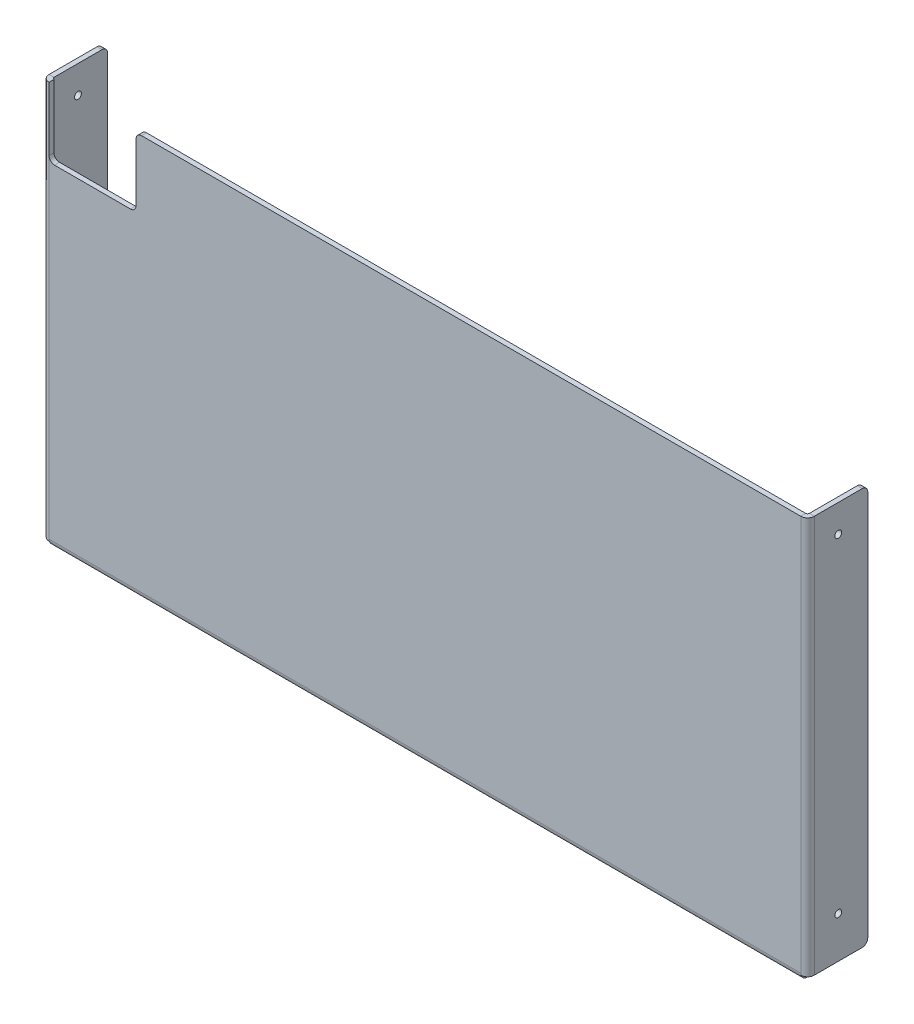
from build123d import *

# Parameters (mm, degrees)
SKETCH1_W                      = 347.1920001
SKETCH1_H                      = 182.714000078
BASE_FLANGE1_DEPTH             = 2.286
EDGE_FLANGE1_STRIP_W           = 10.7696
EDGE_FLANGE1_STRIP_H           = 2.286
EDGE_FLANGE1_STRIP_CUT_DEPTH   = 182.714000078
EDGE_FLANGE1_STRIP_2_W         = 10.7696
EDGE_FLANGE1_STRIP_2_H         = 2.286
EDGE_FLANGE1_STRIP_CUT_2_DEPTH = 182.714000078
EDGE_FLANGE1_DEPTH             = 182.714000078
EDGE_FLANGE1_BEND_DEPTH        = 182.714000078
EDGE_FLANGE2_STRIP_W           = 10.7696
EDGE_FLANGE2_STRIP_H           = 2.286
EDGE_FLANGE2_STRIP_CUT_DEPTH   = 345.5664001
EDGE_FLANGE2_DEPTH             = 345.5664001
SKETCH17_W                     = 40
SKETCH17_H                     = 31.75
CUT_EXTRUDE1_DEPTH             = 201.869732409
FILLET1_R                      = 2.54
F_1_8_0_1250_DOWEL_HOLE1_D     = 3.175
F_1_8_0_1250_DOWEL_HOLE1_DEPTH = 351.7640001
F_1_8_0_1250_DOWEL_HOLE1_TIP   = 0.953866233


# Sheet-metal steps are written as plain solids
with BuildPart() as part:
    # Sketch1 → Base-Flange1 (new body)
    with BuildSketch(Plane.XY):
        Rectangle(SKETCH1_W, SKETCH1_H)
    extrude(amount=-BASE_FLANGE1_DEPTH)

    # Edge-Flange1 strip (across the edge) → Edge-Flange1 strip cut (cut)
    with BuildSketch(Plane(origin=(173.59600005, 91.357000039, -2.286), x_dir=(-1, 0, 0), z_dir=(0, -1, 0))):
        with Locations((-4.572, -1.143)):
            Rectangle(EDGE_FLANGE1_STRIP_W, EDGE_FLANGE1_STRIP_H)
    extrude(amount=EDGE_FLANGE1_STRIP_CUT_DEPTH, mode=Mode.SUBTRACT)

    # Edge-Flange1 strip 2 (across the edge) → Edge-Flange1 strip cut 2 (cut)
    with BuildSketch(Plane(origin=(-173.59600005, -91.357000039, -2.286), x_dir=(1, 0, 0), z_dir=(0, 1, 0))):
        with Locations((-4.572, -1.143)):
            Rectangle(EDGE_FLANGE1_STRIP_2_W, EDGE_FLANGE1_STRIP_2_H)
    extrude(amount=EDGE_FLANGE1_STRIP_CUT_2_DEPTH, mode=Mode.SUBTRACT)

    # Edge-Flange1 section (across the edge) → Edge-Flange1 (add)
    with BuildSketch(Plane(origin=(173.59600005, 91.357000039, -2.286), x_dir=(-1, 0, 0), z_dir=(0, -1, 0))):
        with BuildLine():
            Line((-2.286, 0.8128), (-2.286, 25.4))
            Line((-2.286, 25.4), (0, 25.4))
            Line((0, 25.4), (0, 0.8128))
            ThreePointArc((0, 0.8128), (0.238063608, 0.238063608), (0.8128, 0))
            Line((0.8128, 0), (0.8128, -2.286))
            ThreePointArc((0.8128, -2.286), (-1.378382494, -1.378382494), (-2.286, 0.8128))
        make_face()
    extrude(amount=EDGE_FLANGE1_DEPTH)

    # Edge-Flange1 section 2 (across the edge) → Edge-Flange1 bend (add)
    with BuildSketch(Plane(origin=(-173.59600005, -91.357000039, -2.286), x_dir=(1, 0, 0), z_dir=(0, 1, 0))):
        with BuildLine():
            Line((-2.286, 0.8128), (-2.286, 25.4))
            Line((-2.286, 25.4), (0, 25.4))
            Line((0, 25.4), (0, 0.8128))
            ThreePointArc((0, 0.8128), (0.238063608, 0.238063608), (0.8128, 0))
            Line((0.8128, 0), (0.8128, -2.286))
            ThreePointArc((0.8128, -2.286), (-1.378382494, -1.378382494), (-2.286, 0.8128))
        make_face()
    extrude(amount=EDGE_FLANGE1_BEND_DEPTH)

    # Edge-Flange2 strip (across the edge) → Edge-Flange2 strip cut (cut)
    with BuildSketch(Plane(origin=(172.78320005, -91.357000039, -2.286), x_dir=(0, 1, 0), z_dir=(-1, 0, 0))):
        with Locations((-4.572, -1.143)):
            Rectangle(EDGE_FLANGE2_STRIP_W, EDGE_FLANGE2_STRIP_H)
    extrude(amount=EDGE_FLANGE2_STRIP_CUT_DEPTH, mode=Mode.SUBTRACT)

    # Edge-Flange2 section (across the edge) → Edge-Flange2 (add)
    with BuildSketch(Plane(origin=(172.78320005, -91.357000039, -2.286), x_dir=(0, 1, 0), z_dir=(-1, 0, 0))):
        with BuildLine():
            Line((-2.286, 0.8128), (-2.286, 19.05))
            Line((-2.286, 19.05), (0, 19.05))
            Line((0, 19.05), (0, 0.8128))
            ThreePointArc((0, 0.8128), (0.238063608, 0.238063608), (0.8128, 0))
            Line((0.8128, 0), (0.8128, -2.286))
            ThreePointArc((0.8128, -2.286), (-1.378382494, -1.378382494), (-2.286, 0.8128))
        make_face()
    extrude(amount=EDGE_FLANGE2_DEPTH)

    # Sketch17 → Cut-Extrude1 (cut, through all)
    with BuildSketch(Plane(origin=(0, 0, -2.286), x_dir=(-1, 0, 0), z_dir=(0, 0, -1))):
        with Locations((152.78320005, 75.482000039)):
            Rectangle(SKETCH17_W, SKETCH17_H)
    extrude(amount=-CUT_EXTRUDE1_DEPTH, mode=Mode.SUBTRACT)

    # Fillet1
    fillet1_edges = [part.edges().sort_by_distance(p)[0] for p in [
        (172.78320005, -92.500000039, -21.336),
        (-172.78320005, -92.500000039, -21.336),
        (-172.78320005, 59.607000039, -1.143),
        (-132.78320005, 59.607000039, -1.143),
        (-132.78320005, 91.357000039, -1.143),
        (174.73900005, 91.357000039, -27.686),
        (174.73900005, -91.357000039, -27.686),
        (-174.73900005, -91.357000039, -27.686),
        (-174.73900005, 91.357000039, -27.686),
    ]]
    fillet(fillet1_edges, radius=FILLET1_R)

    # 1/8 (0.1250) Dowel Hole1
    with Locations(Plane.ZY.offset(175.88200005)):
        with Locations((-14.1224, -72.307000039), (-14.1224, 78.657000039)):
            Hole(F_1_8_0_1250_DOWEL_HOLE1_D / 2, depth=F_1_8_0_1250_DOWEL_HOLE1_DEPTH)
            with Locations((0, 0, -(F_1_8_0_1250_DOWEL_HOLE1_DEPTH + F_1_8_0_1250_DOWEL_HOLE1_TIP / 2))):  # 118° drill point
                Cone(0, F_1_8_0_1250_DOWEL_HOLE1_D / 2, F_1_8_0_1250_DOWEL_HOLE1_TIP, mode=Mode.SUBTRACT)


solid = part.part
